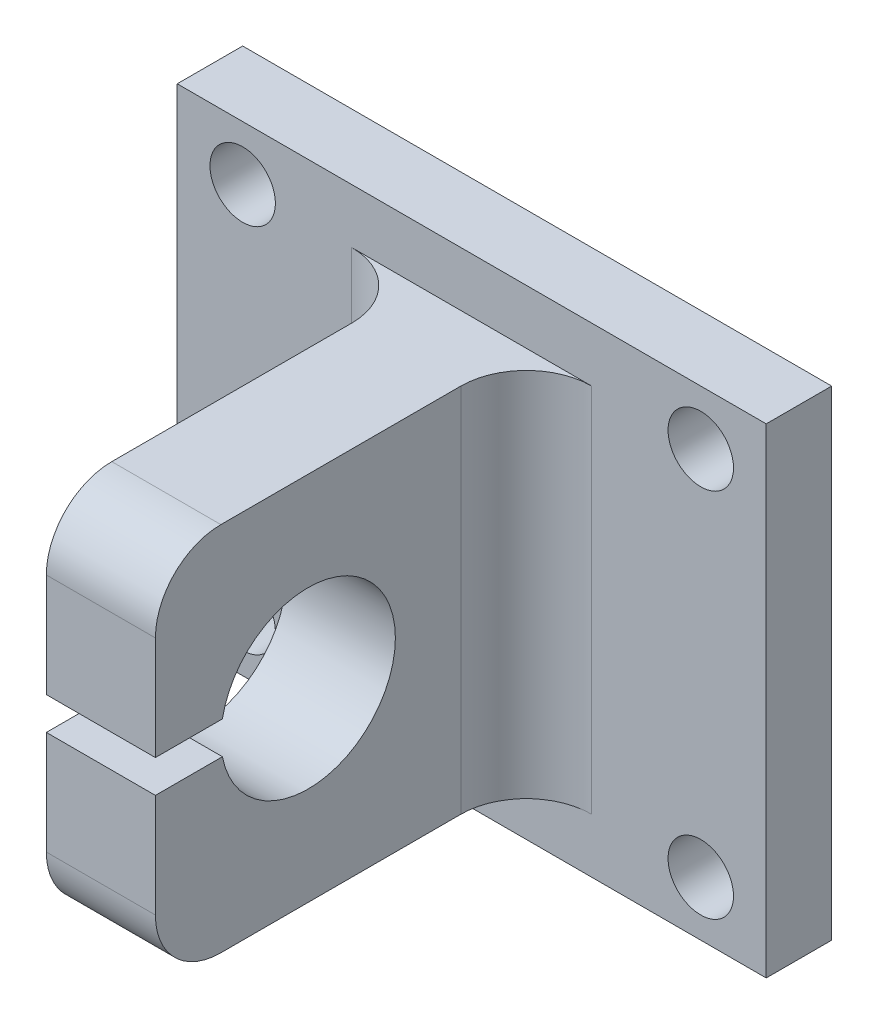
from build123d import *

# Parameters (mm, degrees)
SKETCH1_W               = 27
SKETCH1_H               = 22
SKETCH1_R               = 1.5
BOSS_EXTRUDE1_DEPTH     = 3
SKETCH2_W               = 5
SKETCH2_H               = 17
BOSS_EXTRUDE2_DEPTH     = 17
CUT_EXTRUDE1_DEPTH      = 28.87471973
CUT_EXTRUDE1_DEPTH_BACK = 28.87471973
SKETCH3_R               = 4
CUT_EXTRUDE2_DEPTH      = 28.87471973
CUT_EXTRUDE2_DEPTH_BACK = 28.87471973
SKETCH4_W               = 8.09758535
SKETCH4_H               = 1.5
FILLET1_R               = 3
FILLET2_R               = 3


with BuildPart() as part:
    # Sketch1 → Boss-Extrude1 (new body)
    with BuildSketch(Plane.XY):
        Rectangle(SKETCH1_W, SKETCH1_H)
        with Locations((10.5, 8.5)):
            Circle(SKETCH1_R, mode=Mode.SUBTRACT)
        with Locations((10.5, -8.5)):
            Circle(SKETCH1_R, mode=Mode.SUBTRACT)
        with Locations((-10.5, -8.5)):
            Circle(SKETCH1_R, mode=Mode.SUBTRACT)
        with Locations((-10.5, 8.5)):
            Circle(SKETCH1_R, mode=Mode.SUBTRACT)
    extrude(amount=BOSS_EXTRUDE1_DEPTH)

    # Sketch2 → Boss-Extrude2 (add)
    with BuildSketch(Plane.XY.offset(3)):
        Rectangle(SKETCH2_W, SKETCH2_H)
    extrude(amount=BOSS_EXTRUDE2_DEPTH)

    # Sketch3 → Cut-Extrude1 (cut, two sides: drawn at the far end of the back side and taken through both)
    with BuildSketch(Plane(origin=(2.5, 0, 0), x_dir=(0, 0, -1), z_dir=(1, 0, 0)).offset(-CUT_EXTRUDE1_DEPTH_BACK)):
        with Locations((-13, 0)):
            Circle(SKETCH3_R)
    extrude(amount=CUT_EXTRUDE1_DEPTH + CUT_EXTRUDE1_DEPTH_BACK, mode=Mode.SUBTRACT)

    # Sketch4 → Cut-Extrude2 (cut, two sides: drawn at the far end of the back side and taken through both)
    with BuildSketch(Plane(origin=(2.5, 0, 0), x_dir=(0, 0, -1), z_dir=(1, 0, 0)).offset(-CUT_EXTRUDE2_DEPTH_BACK)):
        with Locations((-18.330812417, 0)):
            Rectangle(SKETCH4_W, SKETCH4_H)
    extrude(amount=CUT_EXTRUDE2_DEPTH + CUT_EXTRUDE2_DEPTH_BACK, mode=Mode.SUBTRACT)

    # Fillet1
    fillet1_edges = [part.edges().sort_by_distance(p)[0] for p in [
        (-2.5, 0, 3),
        (2.5, 0, 3),
    ]]
    fillet(fillet1_edges, radius=FILLET1_R)

    # Fillet2
    fillet2_edges = [part.edges().sort_by_distance(p)[0] for p in [
        (0, 8.5, 20),
        (0, -8.5, 20),
    ]]
    fillet(fillet2_edges, radius=FILLET2_R)


solid = part.part
